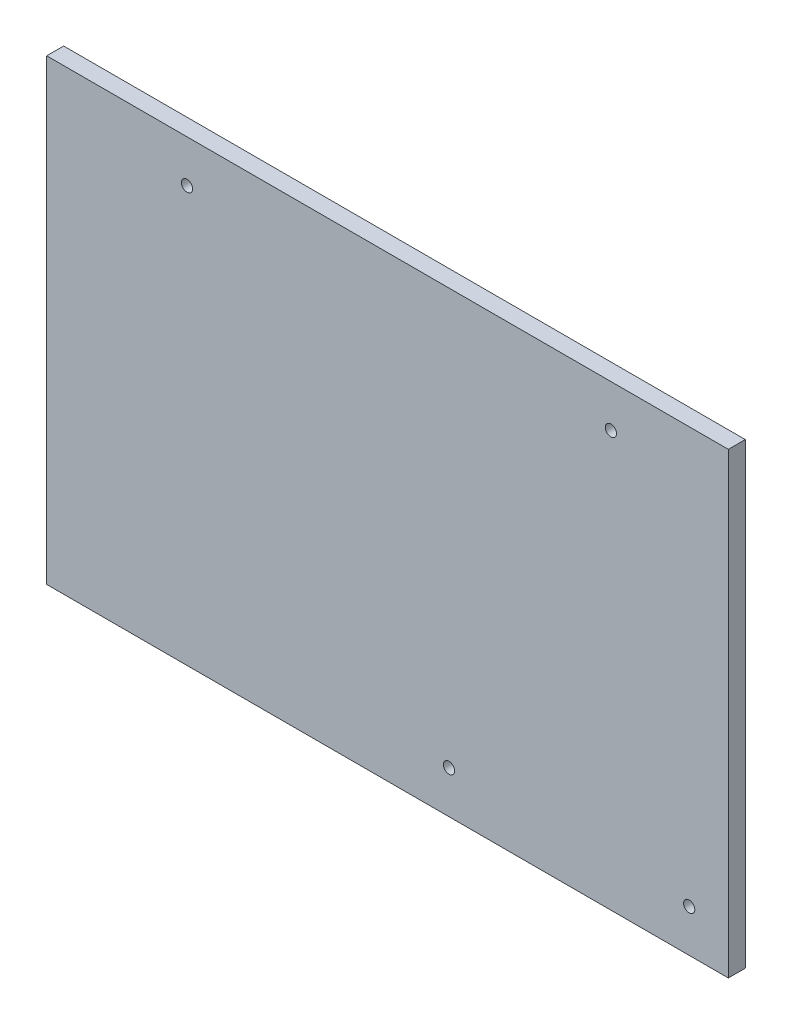
from build123d import *

# Parameters (mm, degrees)
SKETCH1_W           = 255.259874896
SKETCH1_H           = 171.45
BOSS_EXTRUDE1_DEPTH = 6.35
SKETCH7_R           = 2.0955
CUT_EXTRUDE4_DEPTH  = 209.955242778


with BuildPart() as part:
    # Sketch1 → Boss-Extrude1 (new body)
    with BuildSketch(Plane.XY):
        with Locations((-11.719947229, 69.85)):
            Rectangle(SKETCH1_W, SKETCH1_H)
    extrude(amount=BOSS_EXTRUDE1_DEPTH)

    # Sketch7 → Cut-Extrude4 (cut, through all)
    with BuildSketch(Plane(origin=(0, 0, 0), x_dir=(-1, 0, 0), z_dir=(0, 0, -1))):
        with Locations((-11.29241552, 0)):
            Circle(SKETCH7_R)
        with Locations((-101.249233854, 0)):
            Circle(SKETCH7_R)
        with Locations((-71.931365323, 139.7)):
            Circle(SKETCH7_R)
        with Locations((86.818634677, 139.7)):
            Circle(SKETCH7_R)
    extrude(amount=-CUT_EXTRUDE4_DEPTH, mode=Mode.SUBTRACT)


solid = part.part
